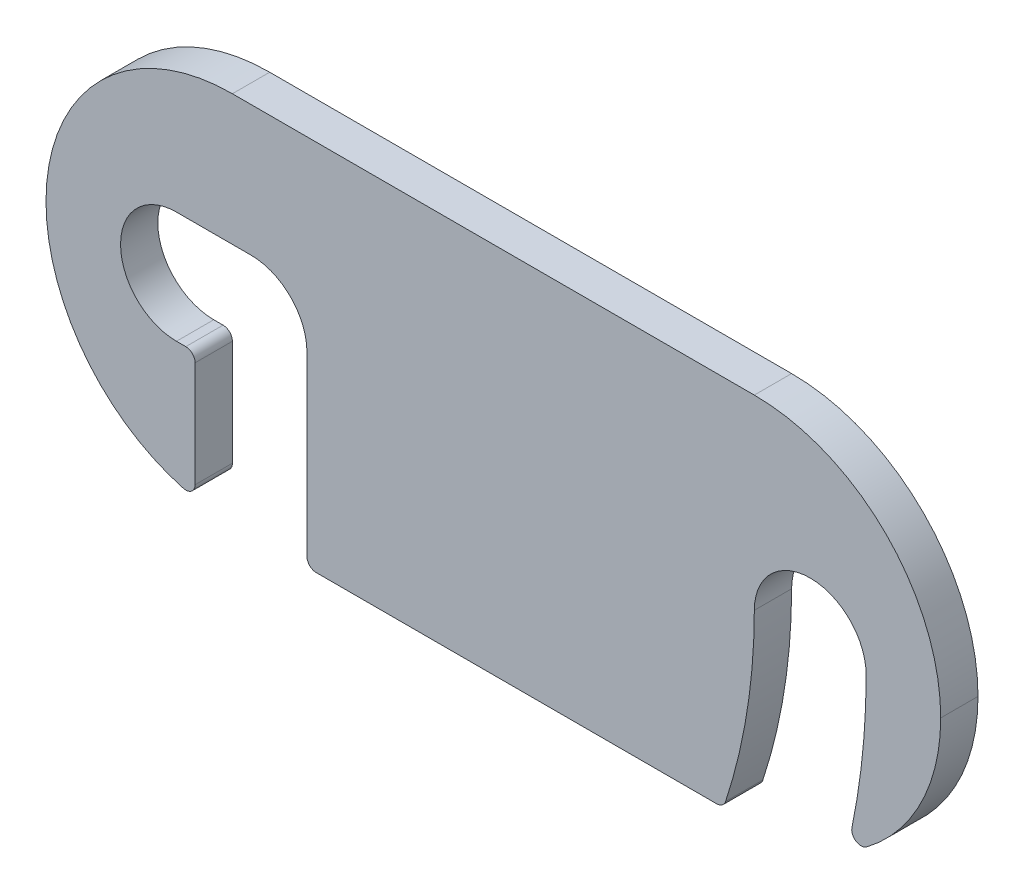
from build123d import *

# Parameters (mm, degrees)
SZKIC1_W                    = 48
SZKIC1_H                    = 20
SZKIC1_R                    = 3
DODANIE_WYCI_GNI_CIE2_DEPTH = 2
ZAOKR_GLENIE3_R             = 10
WYTNIJ_WYCI_GNI_CIE1_DEPTH  = 53.038447325
ZAOKR_GLENIE1_R             = 3
ZAOKR_GLENIE2_R             = 0.5


with BuildPart() as part:
    # Szkic1 → Dodanie-wyciągnięcie2 (new body)
    with BuildSketch(Plane.XY):
        with Locations((-24, -10)):
            Rectangle(SZKIC1_W, SZKIC1_H)
        with Locations((-7, -10)):
            Circle(SZKIC1_R, mode=Mode.SUBTRACT)
        with Locations((-41, -10)):
            Circle(SZKIC1_R, mode=Mode.SUBTRACT)
    extrude(amount=DODANIE_WYCI_GNI_CIE2_DEPTH)

    # Zaokrąglenie3
    zaokr_glenie3_edges = [part.edges().sort_by_distance(p)[0] for p in [
        (0, 0, 1),
        (0, -20, 1),
        (-48, -20, 1),
        (-48, 0, 1),
    ]]
    fillet(zaokr_glenie3_edges, radius=ZAOKR_GLENIE3_R - 0.0001)  # a hair under: the kernel refuses the full size

    # Szkic2 → Wytnij-wyciągnięcie1 (cut, through all)
    with BuildSketch(Plane.XY.offset(2)):
        with BuildLine():
            Line((-10, -10), (-4, -10))
            ThreePointArc((-4, -10), (-4.345859909, -15.047178833), (-5.376973739, -20))
            Line((-5.376973739, -20), (-11.657198498, -20))
            ThreePointArc((-11.657198498, -20), (-10.417105708, -15.068192648), (-10, -10))
        make_face()
        Polygon((-41, -10), (-41, -13), (-40, -13), (-40, -20), (-34, -20), (-34, -17.5), (-34, -7), (-41, -7), align=None)
    extrude(amount=-WYTNIJ_WYCI_GNI_CIE1_DEPTH, mode=Mode.SUBTRACT)

    # Zaokrąglenie1
    zaokr_glenie1_edges = [part.edges().sort_by_distance(p)[0] for p in [
        (-34, -7, 1),
    ]]
    fillet(zaokr_glenie1_edges, radius=ZAOKR_GLENIE1_R)

    # Zaokrąglenie2
    zaokr_glenie2_edges = [part.edges().sort_by_distance(p)[0] for p in [
        (-40, -19.797977321, 1),
        (-5.032269828, -18.678847057, 1),
        (-34, -20, 1),
        (-40, -13, 1),
        (-11.657198498, -20, 1),
    ]]
    fillet(zaokr_glenie2_edges, radius=ZAOKR_GLENIE2_R)


solid = part.part
